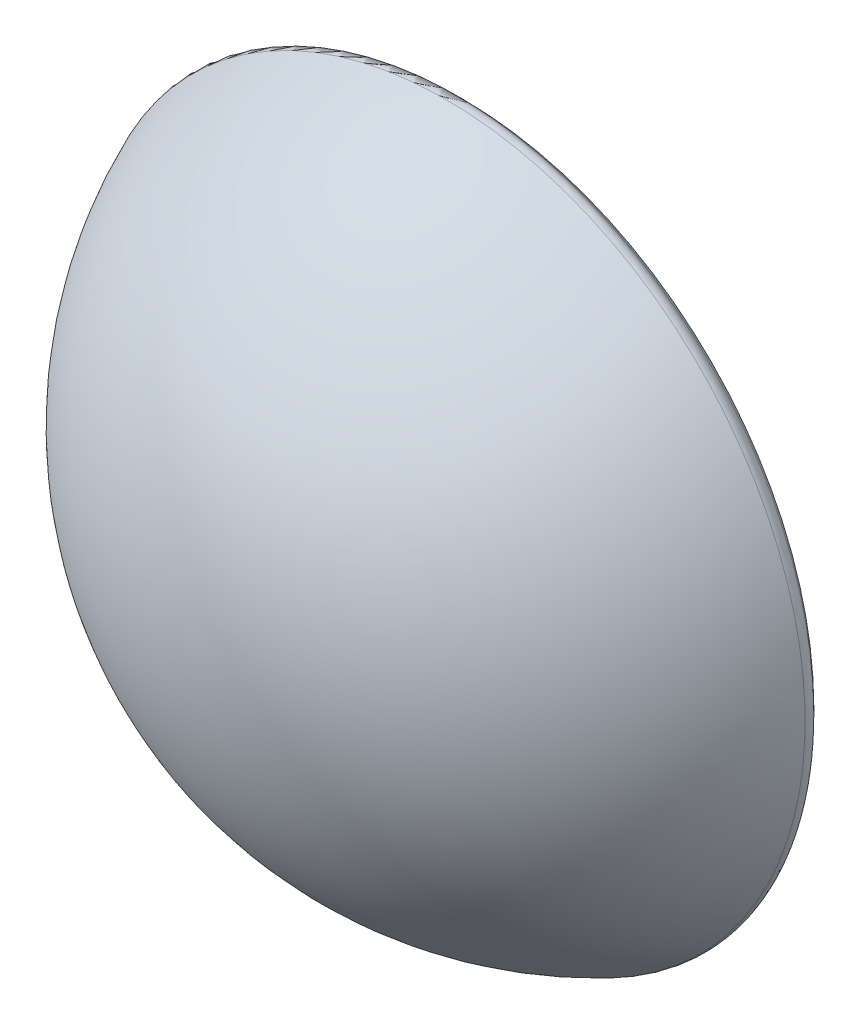
from build123d import *

# Parameters (mm, degrees)
SKETCH1_R                = 31.75
BOSS_EXTRUDE1_DEPTH      = 13
FILLET1_R                = 5
SHELL1_T                 = -1.5
SKETCH9_R                = 35.624492326
SKETCH9_R_2              = 27.25
BOSS_EXTRUDE5_DEPTH      = 2
SKETCH2_W                = 7.351458637
SKETCH2_H                = 15
BOSS_EXTRUDE2_DEPTH      = 2
BOSS_EXTRUDE3_REACH      = 59.839
SKETCH4_W                = 10.926622009
SKETCH4_H                = 2.5
FILLET3_R                = 1
BOSS_EXTRUDE4_REACH      = 60.696
BOSS_EXTRUDE4_END_RADIUS = 38.178049598
SKETCH5_W                = 10.787818312
SKETCH5_H                = 8
SKETCH6_W                = 2
SKETCH6_H                = 4
CUT_EXTRUDE1_DEPTH       = 4
SKETCH7_W                = 4
SKETCH7_H                = 2
CUT_EXTRUDE2_DEPTH       = 4
SKETCH8_W                = 4
SKETCH8_H                = 2
CUT_EXTRUDE3_DEPTH       = 4
FILLET5_R                = 1
CHAMFER2_SIZE            = 1.5
FILLET7_R                = 1
CHAMFER3_SIZE            = 0.5


with BuildPart() as part:
    # Sketch1 → Boss-Extrude1 (new body)
    with BuildSketch(Plane.XY):
        with Locations(Location((0, 0, 0), (0, 0, 180))):
            Circle(SKETCH1_R)
    extrude(amount=BOSS_EXTRUDE1_DEPTH)

    # Fillet1
    fillet1_edges = [part.edges().sort_by_distance(p)[0] for p in [
        (31.75, 0, 13),
    ]]
    fillet(fillet1_edges, radius=FILLET1_R)

    # Sketch12 → Revolve3 (revolve)
    with BuildSketch(Plane(origin=(0, 0, 0), x_dir=(1, 0, 0), z_dir=(0, 1, 0)), mode=Mode.PRIVATE) as revolve3_sk:
        with BuildLine():
            Line((0, -25.950011953), (0, -11.6))
            Line((0, -11.6), (27.242806288, -11.6))
            Line((27.242806288, -11.6), (27.242806288, -11.107193712))
            ThreePointArc((27.242806288, -11.107193712), (29.439924032, -10.197117744), (30.35, -8))
            Line((30.35, -8), (30.35, 0))
            Line((30.35, 0), (37.227524794, 0))
            ThreePointArc((37.227524794, 0), (22.689709797, -18.822303202), (0, -25.950011953))
        make_face()
    revolve(revolve3_sk.sketch.rotate(Axis((0, 0, 27.247512551), (0, 0, -1)), 180), axis=Axis((0, 0, 27.247512551), (0, 0, -1)))

    # Shell1
    shell1_openings = [part.faces().sort_by_distance(p)[0] for p in [
        (0, 0, 0),
    ]]
    offset(amount=SHELL1_T, openings=shell1_openings, kind=Kind.INTERSECTION)

    # Sketch9 → Boss-Extrude5 (add)
    with BuildSketch(Plane(origin=(0, 0, 0), x_dir=(-1, 0, 0), z_dir=(0, 0, -1))):
        Circle(SKETCH9_R)
        Circle(SKETCH9_R_2, mode=Mode.SUBTRACT)
    extrude(amount=-BOSS_EXTRUDE5_DEPTH)

    # Sketch2 → Boss-Extrude2 (add)
    with BuildSketch(Plane(origin=(0, 0, 0), x_dir=(-1, 0, 0), z_dir=(0, 0, -1))):
        with Locations((-27.175729319, 0)):
            Rectangle(SKETCH2_W, SKETCH2_H)
        Polygon((8.93053879, 30.468146923), (5.254809472, 24.101596989), (18.245190528, 16.601596989), (21.920919847, 22.968146923), align=None)
        Polygon((21.920919847, -22.968146923), (18.245190528, -16.601596989), (5.254809472, -24.101596989), (8.93053879, -30.468146923), align=None)
    extrude(amount=-BOSS_EXTRUDE2_DEPTH)

    # Sketch4 → Boss-Extrude3 (add, up to next)
    with BuildSketch(Plane.XY.offset(2), mode=Mode.PRIVATE) as boss_extrude3_sk1:
        with Locations((28.963311004, 6.25)):
            Rectangle(SKETCH4_W, SKETCH4_H)
    boss_extrude3_tool1 = extrude(boss_extrude3_sk1.sketch, amount=BOSS_EXTRUDE3_REACH, mode=Mode.PRIVATE) - part.part
    # Sketch4 → Boss-Extrude3 (add, up to next)
    with BuildSketch(Plane.XY.offset(2), mode=Mode.PRIVATE) as boss_extrude3_sk2:
        with Locations((28.963311004, -6.25)):
            Rectangle(SKETCH4_W, SKETCH4_H)
    boss_extrude3_tool2 = extrude(boss_extrude3_sk2.sketch, amount=BOSS_EXTRUDE3_REACH, mode=Mode.PRIVATE) - part.part
    # Sketch4 → Boss-Extrude3 (add, up to next)
    with BuildSketch(Plane.XY.offset(2), mode=Mode.PRIVATE) as boss_extrude3_sk3:
        Polygon((-16.080127019, -17.851596989), (-21.543438023, -27.314329226), (-23.708501533, -26.064329226), (-18.245190528, -16.601596989), align=None)
    boss_extrude3_tool3 = extrude(boss_extrude3_sk3.sketch, amount=BOSS_EXTRUDE3_REACH, mode=Mode.PRIVATE) - part.part
    # Sketch4 → Boss-Extrude3 (add, up to next)
    with BuildSketch(Plane.XY.offset(2), mode=Mode.PRIVATE) as boss_extrude3_sk4:
        Polygon((-7.419872981, -22.851596989), (-12.883183985, -32.314329226), (-10.718120476, -33.564329226), (-5.254809472, -24.101596989), align=None)
    boss_extrude3_tool4 = extrude(boss_extrude3_sk4.sketch, amount=BOSS_EXTRUDE3_REACH, mode=Mode.PRIVATE) - part.part
    # Sketch4 → Boss-Extrude3 (add, up to next)
    with BuildSketch(Plane.XY.offset(2), mode=Mode.PRIVATE) as boss_extrude3_sk5:
        Polygon((-7.419872981, 22.851596989), (-12.883183985, 32.314329226), (-10.718120476, 33.564329226), (-5.254809472, 24.101596989), align=None)
    boss_extrude3_tool5 = extrude(boss_extrude3_sk5.sketch, amount=BOSS_EXTRUDE3_REACH, mode=Mode.PRIVATE) - part.part
    # Sketch4 → Boss-Extrude3 (add, up to next)
    with BuildSketch(Plane.XY.offset(2), mode=Mode.PRIVATE) as boss_extrude3_sk6:
        Polygon((-16.080127019, 17.851596989), (-21.543438023, 27.314329226), (-23.708501533, 26.064329226), (-18.245190528, 16.601596989), align=None)
    boss_extrude3_tool6 = extrude(boss_extrude3_sk6.sketch, amount=BOSS_EXTRUDE3_REACH, mode=Mode.PRIVATE) - part.part
    add(boss_extrude3_tool1.solids().sort_by_distance((28.963311, 6.25, 2))[0])
    add(boss_extrude3_tool2.solids().sort_by_distance((28.963311, -6.25, 2))[0])
    add(boss_extrude3_tool3.solids().sort_by_distance((-19.894314, -21.957963, 2))[0])
    add(boss_extrude3_tool4.solids().sort_by_distance((-9.068997, -28.207963, 2))[0])
    add(boss_extrude3_tool5.solids().sort_by_distance((-9.068997, 28.207963, 2))[0])
    add(boss_extrude3_tool6.solids().sort_by_distance((-19.894314, 21.957963, 2))[0])

    # Fillet3
    fillet3_edges = [part.edges().sort_by_distance(p)[0] for p in [
        (23.5, -7.5, 7.705328032),
        (23.5, 7.5, 7.705328032),
        (-5.254809472, 24.101596989, 7.705328032),
        (-18.245190528, 16.601596989, 7.705328032),
        (-18.245190528, -16.601596989, 7.705328032),
        (-5.254809472, -24.101596989, 7.705328032),
    ]]
    fillet(fillet3_edges, radius=FILLET3_R)

    # Boss-Extrude4: up to this sphere (the profile starts inside it)
    boss_extrude4_end = Location((0, 0, -13.728037644)) * Sphere(BOSS_EXTRUDE4_END_RADIUS, mode=Mode.PRIVATE)
    # Sketch5 → Boss-Extrude4 (add, up to the surface)
    with BuildSketch(Plane(origin=(0, 0, 0), x_dir=(-1, 0, 0), z_dir=(0, 0, -1)), mode=Mode.PRIVATE) as boss_extrude4_sk1:
        with Locations((29.393909156, 0)):
            Rectangle(SKETCH5_W, SKETCH5_H)
    boss_extrude4_tool1 = extrude(boss_extrude4_sk1.sketch, amount=-BOSS_EXTRUDE4_REACH, mode=Mode.PRIVATE) & boss_extrude4_end
    add(boss_extrude4_tool1.solids().sort_by_distance((-29.393909, 0, 0))[0])
    # Sketch5 → Boss-Extrude4 (add, up to the surface)
    with BuildSketch(Plane(origin=(0, 0, 0), x_dir=(-1, 0, 0), z_dir=(0, 0, -1)), mode=Mode.PRIVATE) as boss_extrude4_sk2:
        Polygon((-8.535898385, -22.784609691), (-15.464101615, -18.784609691), (-20.858010771, -28.127134401), (-13.929807541, -32.127134401), align=None)
    boss_extrude4_tool2 = extrude(boss_extrude4_sk2.sketch, amount=-BOSS_EXTRUDE4_REACH, mode=Mode.PRIVATE) & boss_extrude4_end
    add(boss_extrude4_tool2.solids().sort_by_distance((14.696955, -25.455872, 0))[0])
    # Sketch5 → Boss-Extrude4 (add, up to the surface)
    with BuildSketch(Plane(origin=(0, 0, 0), x_dir=(-1, 0, 0), z_dir=(0, 0, -1)), mode=Mode.PRIVATE) as boss_extrude4_sk3:
        Polygon((-15.464101615, 18.784609691), (-8.535898385, 22.784609691), (-13.929807541, 32.127134401), (-20.858010771, 28.127134401), align=None)
    boss_extrude4_tool3 = extrude(boss_extrude4_sk3.sketch, amount=-BOSS_EXTRUDE4_REACH, mode=Mode.PRIVATE) & boss_extrude4_end
    add(boss_extrude4_tool3.solids().sort_by_distance((14.696955, 25.455872, 0))[0])

    # Sketch6 → Cut-Extrude1 (cut)
    with BuildSketch(Plane(origin=(-24, 0, 0), x_dir=(0, 0, -1), z_dir=(1, 0, 0))):
        with Locations((-6, 0)):
            Rectangle(SKETCH6_W, SKETCH6_H)
    extrude(amount=-CUT_EXTRUDE1_DEPTH, mode=Mode.SUBTRACT)

    # Sketch7 → Cut-Extrude2 (cut)
    with BuildSketch(Plane(origin=(12, -20.784609691, 0), x_dir=(0.8660254037844365, 0.5000000000000039, 0), z_dir=(-0.5000000000000038, 0.8660254037844364, 0))):
        with Locations((0, -6)):
            Rectangle(SKETCH7_W, SKETCH7_H)
    extrude(amount=-CUT_EXTRUDE2_DEPTH, mode=Mode.SUBTRACT)

    # Sketch8 → Cut-Extrude3 (cut)
    with BuildSketch(Plane(origin=(12, 20.784609691, 0), x_dir=(0.8660254037844257, -0.5000000000000224, 0), z_dir=(-0.5000000000000224, -0.8660254037844258, 0))):
        with Locations((0, 6)):
            Rectangle(SKETCH8_W, SKETCH8_H)
    extrude(amount=-CUT_EXTRUDE3_DEPTH, mode=Mode.SUBTRACT)

    # Fillet5
    fillet5_edges = [part.edges().sort_by_distance(p)[0] for p in [
        (-24, -4, 7.846211216),
        (-24, 4, 7.846211216),
        (15.464101615, -18.784609691, 7.846211216),
        (8.535898385, -22.784609691, 7.846211216),
        (8.535898385, 22.784609691, 7.846211216),
        (15.464101615, 18.784609691, 7.846211216),
    ]]
    fillet(fillet5_edges, radius=FILLET5_R)

    # Chamfer2
    # the kernel refuses this chamfer: 1.5, 1.168019183 mm, written as the material it takes off along each edge
    with BuildSketch(Plane(origin=(0, 0, 0), x_dir=(-1, 0, 0), z_dir=(0, -1, 0))) as chamfer2_piece_1:
        with BuildLine():
            Line((37.227524794 - CHAMFER2_SIZE, 0), (36.810195939, -1.082671144))
            ThreePointArc((36.810195939, -1.082671144), (37.018444042, -0.554203797), (37.227524794, 0))
            Line((37.227524794, 0), (37.227524794 - CHAMFER2_SIZE, 0))
        make_face()
    revolve(axis=Axis((0, 0, 0), (0, 0, -1)), mode=Mode.SUBTRACT)

    # Fillet7
    fillet7_edges = [part.edges().sort_by_distance(p)[0] for p in [
        (36.810195939, 0, 1.082671144),
    ]]
    fillet(fillet7_edges, radius=FILLET7_R)

    # Chamfer3
    chamfer3_edges = [part.edges().sort_by_distance(p)[0] for p in [
        (-11.75, 20.351596989, 0),
        (-11.75, -20.351596989, 0),
        (-6.179201142, -25.702690328, 0),
        (23.5, 0, 0),
        (25.34878334, 7.5, 0),
        (-19.169582199, 18.202690328, 0),
        (-5.654909049, -24.208803348, 0),
        (-18.13798417, -17.001696566, 0),
        (23.792893219, -7.207106781, 0),
        (23.792893219, 7.207106781, 0),
        (-5.654909049, 24.208803348, 0),
        (-18.13798417, 17.001696566, 0),
        (25.34878334, -7.5, 0),
        (-6.179201142, 25.702690328, 0),
        (-19.169582199, -18.202690328, 0),
    ]]
    chamfer(chamfer3_edges, length=CHAMFER3_SIZE)


solid = part.part
